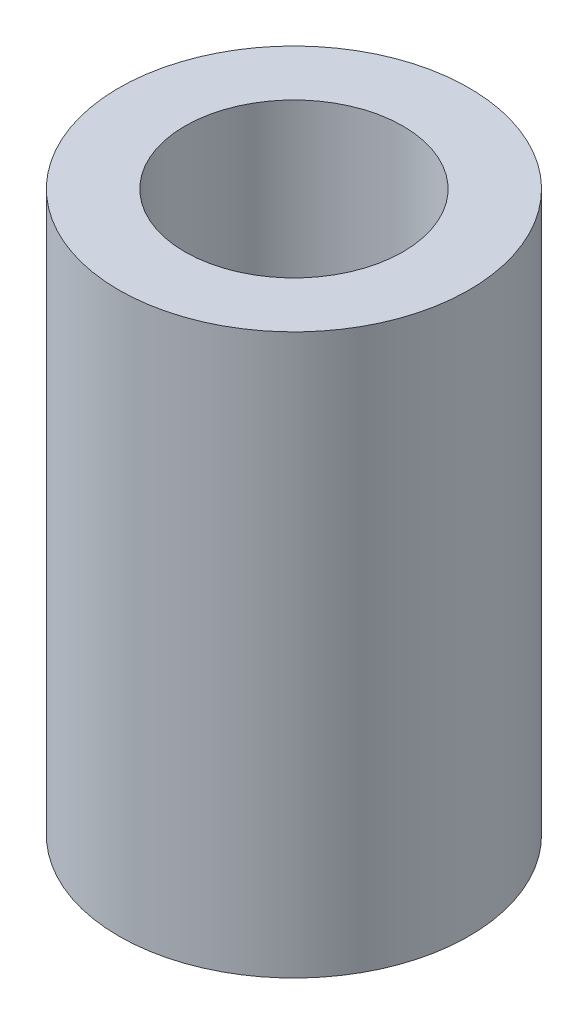
from build123d import *

# Parameters (mm, degrees)
SKETCH1_R           = 10
BOSS_EXTRUDE1_DEPTH = 31.962113436
SKETCH2_R           = 6.227008167
CUT_EXTRUDE1_DEPTH  = 35.951061433


with BuildPart() as part:
    # Sketch1 → Boss-Extrude1 (new body)
    with BuildSketch(Plane(origin=(0, 0, 0), x_dir=(1, 0, 0), z_dir=(0, 1, 0))):
        Circle(SKETCH1_R)
    extrude(amount=BOSS_EXTRUDE1_DEPTH)

    # Sketch2 → Cut-Extrude1 (cut, through all)
    with BuildSketch(Plane(origin=(0, 0, 0), x_dir=(1, 0, 0), z_dir=(0, 1, 0))):
        Circle(SKETCH2_R)
    extrude(amount=CUT_EXTRUDE1_DEPTH, mode=Mode.SUBTRACT)


solid = part.part
